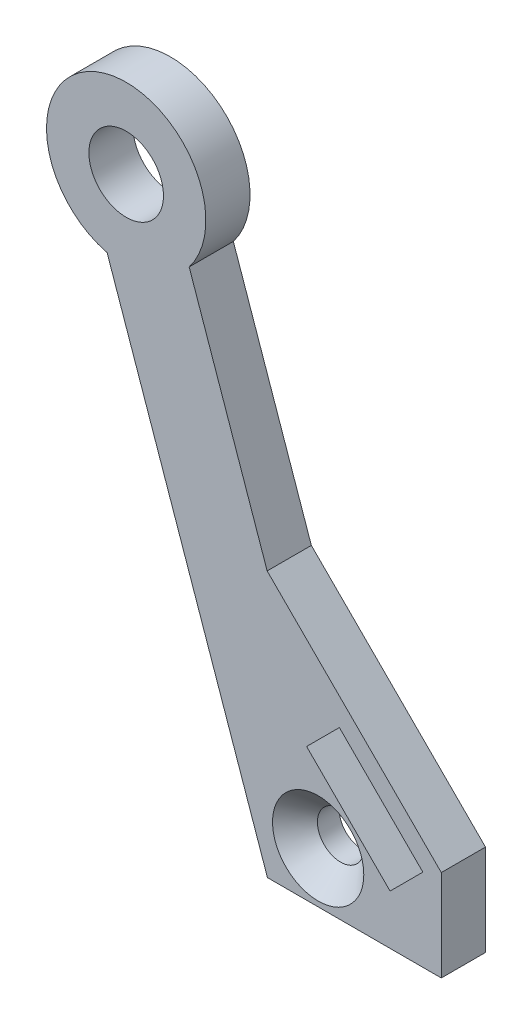
from build123d import *

# Parameters (mm, degrees)
SKETCH1_R           = 1.5
SKETCH1_R_2         = 2.575
BOSS_EXTRUDE1_DEPTH = 3.05


with BuildPart() as part:
    # Sketch1 → Boss-Extrude1 (new body)
    with BuildSketch(Plane.XY):
        with BuildLine():
            Line((-11.072019808, 31.834366558), (0, 0))
            Line((0, 0), (12, 0))
            Line((12, 0), (12, 6.303908615))
            Line((12, 6.303908615), (-0.02081528, 18.324723896))
            Line((-0.02081528, 18.324723896), (-5.404994656, 33.805362734))
            ThreePointArc((-5.404994656, 33.805362734), (-11.559560965, 42.368586897), (-11.072019808, 31.834366558))
        make_face()
        with Locations((3.5, 3.5)):
            Circle(SKETCH1_R, mode=Mode.SUBTRACT)
        Polygon((10.727207794, 5.692209589), (8.517499103, 3.482500897), (8.464466094, 3.429467889), (2.701545827, 9.192388155), (4.964287527, 11.455129855), align=None, mode=Mode.SUBTRACT)
        with Locations((-9.752814471, 37.173813841)):
            Circle(SKETCH1_R_2, mode=Mode.SUBTRACT)
    extrude(amount=BOSS_EXTRUDE1_DEPTH)

    # Sketch3 → CSK for M3 Flat Head Machine Screw1 (revolve, cut)
    with BuildSketch(Plane(origin=(3.5, 3.5, 3.05), x_dir=(0, -1, 0), z_dir=(1, 0, 0))):
        Polygon((0, 0), (0, 3.05), (1.6, 3.05), (1.6, 1.55), (3.15, 0), align=None)
    revolve(axis=Axis((3.5, 3.5, 9.4), (0, 0, -1)), mode=Mode.SUBTRACT)


solid = part.part
